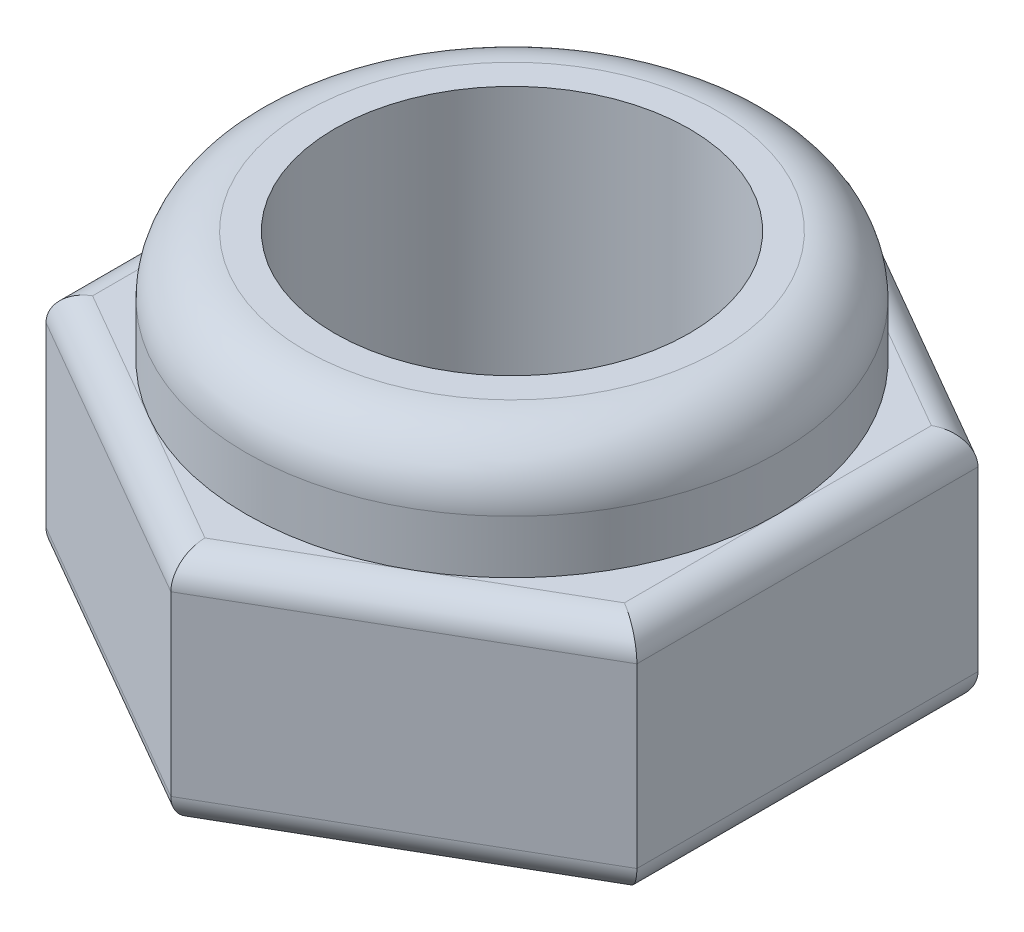
from build123d import *

# Parameters (mm, degrees)
EXTRUDE_1_DEPTH     = 4
SKETCH_2_R          = 4.5
EXTRUDE_2_DEPTH     = 1.9
SKETCH_3_R          = 3
CUT_EXTRUDE_1_DEPTH = 20
FILLET_1_R          = 1
FILLET_3_R          = 0.5


with BuildPart() as part:
    # 草图1 → 凸台-拉伸1 (new body)
    with BuildSketch(Plane(origin=(0, 0, 0), x_dir=(1, 0, 0), z_dir=(0, 1, 0))):
        Polygon((0, -5.773502692), (5, -2.886751346), (5, 2.886751346), (0, 5.773502692), (-5, 2.886751346), (-5, -2.886751346), align=None)
    extrude(amount=EXTRUDE_1_DEPTH)

    # 草图2 → 凸台-拉伸2 (add)
    with BuildSketch(Plane(origin=(0, 4, 0), x_dir=(1, 0, 0), z_dir=(0, 1, 0))):
        with Locations(Location((0, 0, 0), (0, 0, 90))):
            Circle(SKETCH_2_R)
    extrude(amount=EXTRUDE_2_DEPTH)

    # 草图3 → 切除-拉伸1 (cut)
    with BuildSketch(Plane(origin=(0, 5.9, 0), x_dir=(1, 0, 0), z_dir=(0, 1, 0))):
        with Locations(Location((0, 0, 0), (0, 0, 270))):
            Circle(SKETCH_3_R)
    extrude(amount=-CUT_EXTRUDE_1_DEPTH, mode=Mode.SUBTRACT)

    # 圆角1
    fillet_1_edges = [part.edges().sort_by_distance(p)[0] for p in [
        (0, 5.9, 4.5),
    ]]
    fillet(fillet_1_edges, radius=FILLET_1_R)

    # 圆角3
    fillet_3_edges = [part.edges().sort_by_distance(p)[0] for p in [
        (5, 4, 0),
        (2.5, 4, -4.330127019),
        (-2.5, 4, -4.330127019),
        (-5, 4, 0),
        (-2.5, 4, 4.330127019),
        (-5, 0, 0),
        (-2.5, 0, -4.330127019),
        (2.5, 0, -4.330127019),
        (5, 0, 0),
        (2.5, 0, 4.330127019),
        (-2.5, 0, 4.330127019),
        (2.5, 4, 4.330127019),
    ]]
    fillet(fillet_3_edges, radius=FILLET_3_R - 0.0001)  # a hair under: the kernel refuses the full size


solid = part.part
